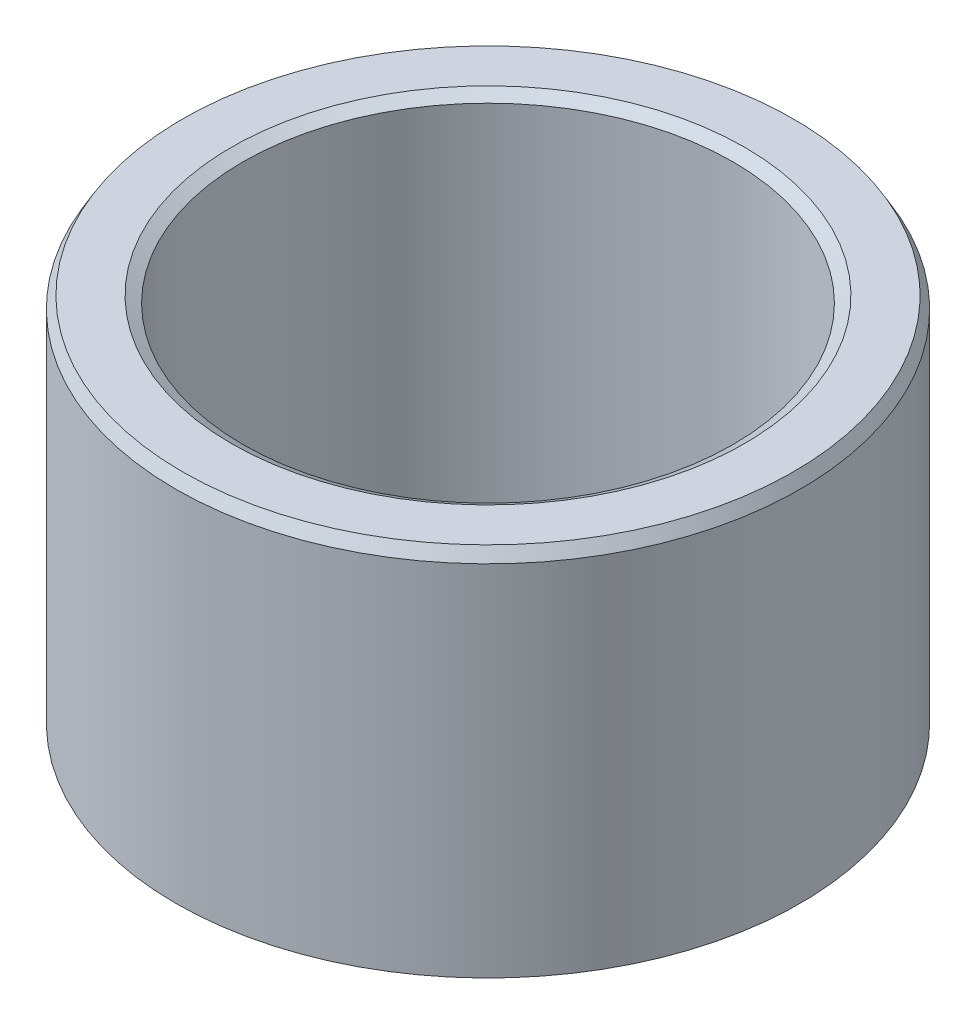
from build123d import *
from OCP.BRepFilletAPI import BRepFilletAPI_MakeChamfer

# Parameters (mm, degrees)
SKETCH1_R           = 60
BOSS_EXTRUDE1_DEPTH = 72.452018625
SKETCH2_R           = 47.06303749
CUT_EXTRUDE1_DEPTH  = 112.57640881
CHAMFER1_SIZE       = 2.245135642
CHAMFER1_SIZE2      = 1.296229667


with BuildPart() as part:
    # Sketch1 → Boss-Extrude1 (new body)
    with BuildSketch(Plane(origin=(0, 0, 0), x_dir=(1, 0, 0), z_dir=(0, 1, 0))):
        Circle(SKETCH1_R)
    extrude(amount=BOSS_EXTRUDE1_DEPTH)

    # Sketch2 → Cut-Extrude1 (cut, through all)
    with BuildSketch(Plane(origin=(0, 0, 0), x_dir=(1, 0, 0), z_dir=(0, 1, 0))):
        Circle(SKETCH2_R)
    extrude(amount=CUT_EXTRUDE1_DEPTH, mode=Mode.SUBTRACT)

    # Chamfer1: one chamfer whose edges measure the first distance from different faces: ONE call of the kernel's chamfer builder (chamfer() names one face for all edges)
    chamfer1_edges_1 = [part.edges().sort_by_distance(p)[0] for p in [
        (-47.06303749, 72.452018625, 0),
    ]]
    chamfer1_side_1 = [part.faces().sort_by_distance(p)[0] for p in [
        (-58.302943725, 72.452018625, 0),
    ]]
    chamfer1_edges_2 = [part.edges().sort_by_distance(p)[0] for p in [
        (-47.06303749, 0, 0),
    ]]
    chamfer1_side_2 = [part.faces().sort_by_distance(p)[0] for p in [
        (-47.06303749, 36.226009313, 0),
    ]]
    chamfer1_edges_3 = [part.edges().sort_by_distance(p)[0] for p in [
        (-60, 0, 0),
    ]]
    chamfer1_side_3 = [part.faces().sort_by_distance(p)[0] for p in [
        (-58.302943725, 0, 0),
    ]]
    chamfer1_edges_4 = [part.edges().sort_by_distance(p)[0] for p in [
        (-60, 72.452018625, 0),
    ]]
    chamfer1_side_4 = [part.faces().sort_by_distance(p)[0] for p in [
        (-60, 36.226009313, 0),
    ]]
    chamfer1 = BRepFilletAPI_MakeChamfer(part.part.solid().wrapped)
    for e in chamfer1_edges_1:
        chamfer1.Add(CHAMFER1_SIZE, CHAMFER1_SIZE2, e.wrapped, chamfer1_side_1[0].wrapped)  # the first distance lies on this face
    for e in chamfer1_edges_2:
        chamfer1.Add(CHAMFER1_SIZE, CHAMFER1_SIZE2, e.wrapped, chamfer1_side_2[0].wrapped)  # the first distance lies on this face
    for e in chamfer1_edges_3:
        chamfer1.Add(CHAMFER1_SIZE, CHAMFER1_SIZE2, e.wrapped, chamfer1_side_3[0].wrapped)  # the first distance lies on this face
    for e in chamfer1_edges_4:
        chamfer1.Add(CHAMFER1_SIZE, CHAMFER1_SIZE2, e.wrapped, chamfer1_side_4[0].wrapped)  # the first distance lies on this face
    add(Compound.cast(chamfer1.Shape()), mode=Mode.REPLACE)


solid = part.part
